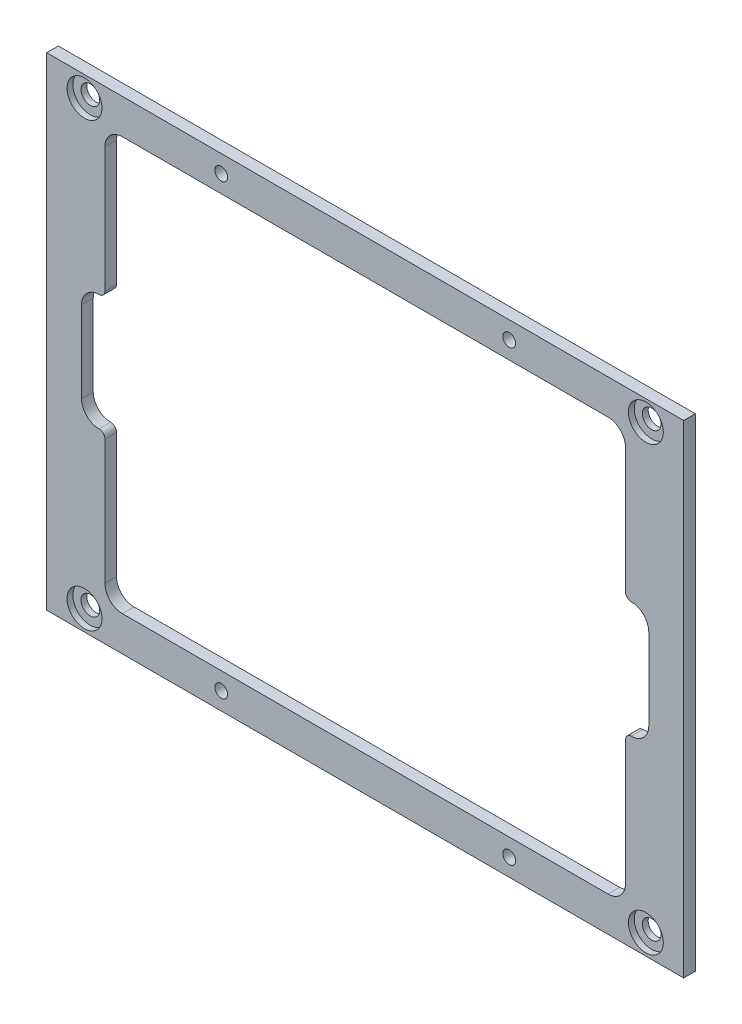
from build123d import *

# Parameters (mm, degrees)
SKETCH1_W                  = 109.5
SKETCH1_H                  = 83
BOSS_EXTRUDE1_DEPTH        = 2
F_3_2_3_2_DIAMETER_HOLE1_D = 3.2
F_2_2_2_2_DIAMETER_HOLE1_D = 2.2
SKETCH12_R                 = 3
CUT_EXTRUDE1_DEPTH         = 1
FILLET1_R                  = 3
FILLET2_R                  = 1


with BuildPart() as part:
    # Sketch1 → Boss-Extrude1 (new body)
    with BuildSketch(Plane.XY.offset(7.43465612)):
        with Locations((-0.743641502, 44.95185693)):
            Rectangle(SKETCH1_W, SKETCH1_H)
        with BuildLine():
            Line((-42.493641502, 80.45185693), (41.006358498, 80.45185693))
            ThreePointArc((41.006358498, 80.45185693), (43.127678842, 79.573177274), (44.006358498, 77.45185693))
            Line((44.006358498, 77.45185693), (44.006358498, 54.95185693))
            Line((44.006358498, 54.95185693), (48.006358498, 54.95185693))
            Line((48.006358498, 54.95185693), (48.006358498, 44.95185693))
            Line((48.006358498, 44.95185693), (48.006358498, 34.95185693))
            Line((48.006358498, 34.95185693), (44.006358498, 34.95185693))
            Line((44.006358498, 34.95185693), (44.006358498, 12.45185693))
            ThreePointArc((44.006358498, 12.45185693), (43.127678842, 10.330536587), (41.006358498, 9.45185693))
            Line((41.006358498, 9.45185693), (-42.493641502, 9.45185693))
            ThreePointArc((-42.493641502, 9.45185693), (-44.614961845, 10.330536587), (-45.493641502, 12.45185693))
            Line((-45.493641502, 12.45185693), (-45.493641502, 34.95185693))
            Line((-45.493641502, 34.95185693), (-49.493641502, 34.95185693))
            Line((-49.493641502, 34.95185693), (-49.493641502, 54.95185693))
            Line((-49.493641502, 54.95185693), (-45.493641502, 54.95185693))
            Line((-45.493641502, 54.95185693), (-45.493641502, 77.45185693))
            ThreePointArc((-45.493641502, 77.45185693), (-44.614961845, 79.573177274), (-42.493641502, 80.45185693))
        make_face(mode=Mode.SUBTRACT)
    extrude(amount=BOSS_EXTRUDE1_DEPTH)

    # Ø3.2 (3.2) Diameter Hole1 (through all)
    with Locations(Plane.XY.offset(9.43465612)):
        with Locations((-48.993641502, 6.95185693), (-48.993641502, 82.95185693), (47.506358498, 82.95185693), (47.506358498, 6.95185693)):
            Hole(F_3_2_3_2_DIAMETER_HOLE1_D / 2)

    # Ø2.2 (2.2) Diameter Hole1 (through all)
    with Locations(Plane(origin=(-25.493641502, 83.45185693, 9.43465612), x_dir=(1, 0, 0), z_dir=(0, 0, 1))):
        with Locations((0, 0), (49.5, 0), (49.5, -77), (0, -77)):
            Hole(F_2_2_2_2_DIAMETER_HOLE1_D / 2)

    # Sketch12 → Cut-Extrude1 (cut)
    with BuildSketch(Plane.XY.offset(9.43465612)):
        with Locations((-48.993641502, 82.95185693)):
            Circle(SKETCH12_R)
        with Locations((47.506358498, 82.95185693)):
            Circle(SKETCH12_R)
        with Locations((47.506358498, 6.95185693)):
            Circle(SKETCH12_R)
        with Locations((-48.993641502, 6.95185693)):
            Circle(SKETCH12_R)
    extrude(amount=-CUT_EXTRUDE1_DEPTH, mode=Mode.SUBTRACT)

    # Fillet1
    fillet1_edges = [part.edges().sort_by_distance(p)[0] for p in [
        (48.006358498, 34.95185693, 8.43465612),
        (48.006358498, 54.95185693, 8.43465612),
        (-49.493641502, 54.95185693, 8.43465612),
        (-49.493641502, 34.95185693, 8.43465612),
    ]]
    fillet(fillet1_edges, radius=FILLET1_R)

    # Fillet2
    fillet2_edges = [part.edges().sort_by_distance(p)[0] for p in [
        (44.006358498, 34.95185693, 8.43465612),
        (44.006358498, 54.95185693, 8.43465612),
        (-45.493641502, 34.95185693, 8.43465612),
        (-45.493641502, 54.95185693, 8.43465612),
    ]]
    fillet(fillet2_edges, radius=FILLET2_R - 0.0001)  # a hair under: the kernel refuses the full size


solid = part.part
